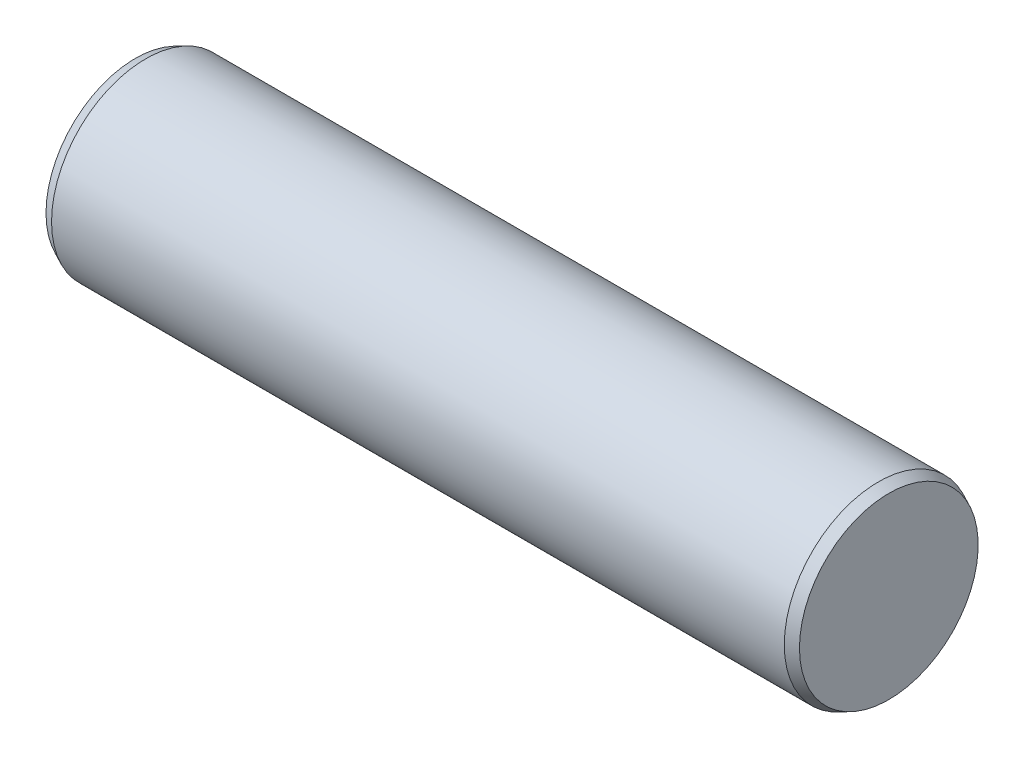
from build123d import *


with BuildPart() as part:
    # Sketch1 → Base-Revolve (revolve)
    with BuildSketch(Plane.XY):
        Polygon((0, 0), (101.6, 0), (101.6, 12.048568202), (100.203, 12.7), (1.397, 12.7), (0, 12.048568202), align=None)
    revolve(axis=Axis((-6.35, 0, 0), (1, 0, 0)))


solid = part.part
